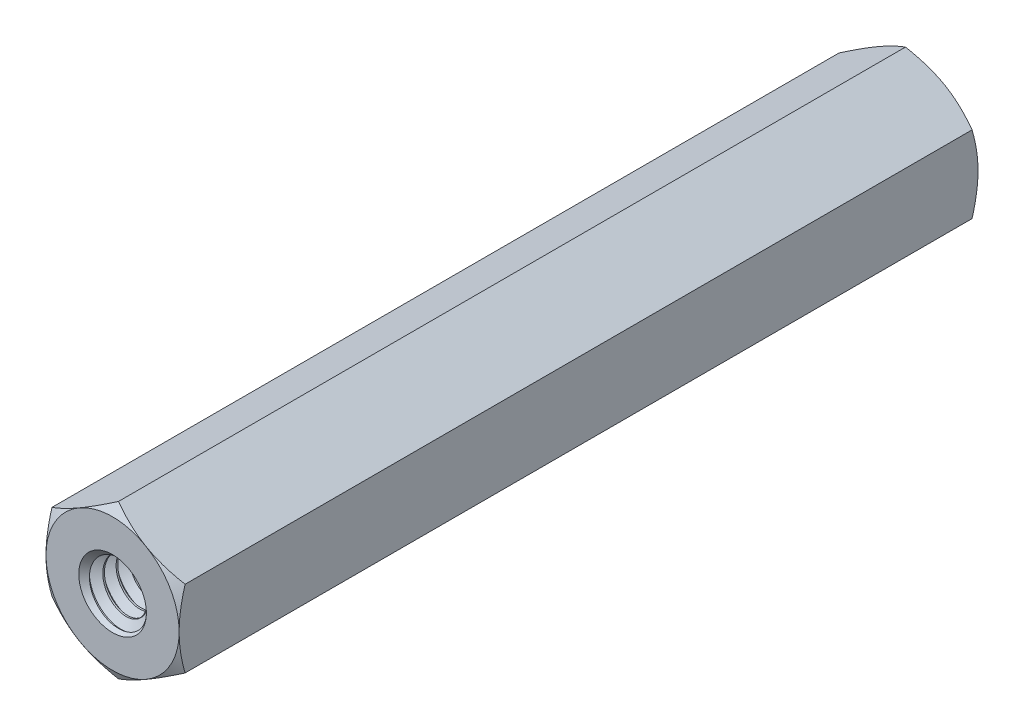
from build123d import *

# Parameters (mm, degrees)
EXTRUDE1_DEPTH          = 38.1
EXTRUDE1_DEPTH_BACK     = 38.1
SKETCH1_R               = 3.175
SWEEP1_PITCH            = 1.27
EXTRUDE2_DEPTH          = 79.075050996
SKETCH8_OUTSIDE_W       = 304.596
SKETCH8_OUTSIDE_H       = 306.56
SKETCH8_OUTSIDE_R       = 6.35
EXTRUDE4_DEPTH          = 79.075050996
EXTRUDE4_DRAFT          = -60
MIRROR1_COPY_1_SKETCH_W = 304.596
MIRROR1_COPY_1_SKETCH_H = 306.56
MIRROR1_COPY_1_SKETCH_R = 6.35
MIRROR1_COPY_1_DEPTH    = 79.075050996
MIRROR1_COPY_1_DRAFT    = -60
SKETCH9_W               = 44.45
SKETCH9_H               = 3.2258


with BuildPart() as part:
    # Sketch1 → Extrude1 (new, two sides: drawn at the far end of the back side and taken through both)
    with BuildSketch(Plane.XY.offset(-EXTRUDE1_DEPTH_BACK)):
        Polygon((0, 7.332348419), (-6.35, 3.666174209), (-6.35, -3.666174209), (0, -7.332348419), (6.35, -3.666174209), (6.35, 3.666174209), align=None)
        with Locations(Location((0, 0, 0), (0, 0, 180))):
            Circle(SKETCH1_R, mode=Mode.SUBTRACT)
    extrude(amount=EXTRUDE1_DEPTH + EXTRUDE1_DEPTH_BACK)

    # Sweep1: the profile of Sketch12 profile screwed along a right-hand helix of 61 turns, 6 arcs to a turn; built about Z, then put on its axis
    sweep1_z = Axis((0, 0, 0), (0, 0, 1))
    sweep1_corners = [(3.1753, 0, -1.111423205), (3.1753, 0, 0.000173205), (2.350110803, 0, -0.47625), (2.350110803, 0, -0.635)]
    with BuildLine(mode=Mode.PRIVATE) as sweep1_profile:
        Line(sweep1_corners[0], sweep1_corners[1])
        Line(sweep1_corners[1], sweep1_corners[2])
        Line(sweep1_corners[2], sweep1_corners[3])
        Line(sweep1_corners[3], sweep1_corners[0])
    sweep1_cap = Face(sweep1_profile.wire())
    sweep1_turn_angles = [0, 30, 60, 90, 120, 150, 180, 210, 240, 270, 300, 330, 360, 390, 420, 450, 480, 510, 540, 570, 600, 630, 660, 690, 720]
    sweep1_turn_weights = [1, 0.8660254037844387, 1, 0.8660254037844387, 1, 0.8660254037844387, 1, 0.8660254037844387, 1, 0.8660254037844387, 1, 0.8660254037844387, 1, 0.8660254037844387, 1, 0.8660254037844387, 1, 0.8660254037844387, 1, 0.8660254037844387, 1, 0.8660254037844387, 1, 0.8660254037844387, 1]
    sweep1_turn_rails = [Edge.make_bspline([Vector(p[0], p[1], 0).rotate(sweep1_z, sweep1_turn_angles[k]) / sweep1_turn_weights[k] + Vector(0, 0, p[2] + SWEEP1_PITCH * sweep1_turn_angles[k] / 360) for k in range(25)], [0, 0, 0, 1, 1, 2, 2, 3, 3, 4, 4, 5, 5, 6, 6, 7, 7, 8, 8, 9, 9, 10, 10, 11, 11, 12, 12, 12], 2, sweep1_turn_weights) for p in sweep1_corners]
    sweep1_turn_sides = [Face.make_surface_from_curves(sweep1_turn_rails[p[0]], sweep1_turn_rails[p[1]]) for p in [(0, 1), (1, 2), (2, 3), (3, 0)]]
    sweep1_last_angles = [21600, 21630, 21660, 21690, 21720, 21750, 21780, 21810, 21840, 21870, 21900, 21930, 21960]
    sweep1_last_weights = [1, 0.8660254037844387, 1, 0.8660254037844387, 1, 0.8660254037844387, 1, 0.8660254037844387, 1, 0.8660254037844387, 1, 0.8660254037842006, 1]
    sweep1_last_rails = [Edge.make_bspline([Vector(p[0], p[1], 0).rotate(sweep1_z, sweep1_last_angles[k]) / sweep1_last_weights[k] + Vector(0, 0, p[2] + SWEEP1_PITCH * sweep1_last_angles[k] / 360) for k in range(13)], [0, 0, 0, 1, 1, 2, 2, 3, 3, 4, 4, 5, 5, 6, 6, 6], 2, sweep1_last_weights) for p in sweep1_corners]
    sweep1_last_sides = [Face.make_surface_from_curves(sweep1_last_rails[p[0]], sweep1_last_rails[p[1]]) for p in [(0, 1), (1, 2), (2, 3), (3, 0)]]
    sweep1 = Plane(origin=(0, 0, -38.1), x_dir=(0, 1, 0), z_dir=(0, 0, 1)) * Solid(Shell([*[p.moved(Location((0, 0, 2 * SWEEP1_PITCH * i))) for i in range(30) for p in sweep1_turn_sides], *sweep1_last_sides, sweep1_cap, sweep1_cap.rotate(sweep1_z, 21960).moved(Location((0, 0, SWEEP1_PITCH * 21960 / 360)))]))
    add(sweep1)

    # Sketch6 → Extrude2 (cut, through all)
    with BuildSketch(Plane(origin=(0, 0, -38.1), x_dir=(-1, 0, 0), z_dir=(0, 0, -1))):
        Polygon((0, 7.332348419), (-6.35, 3.666174209), (-6.35, -3.666174209), (0, -7.332348419), (6.35, -3.666174209), (6.35, 3.666174209), align=None)
    extrude2 = extrude(amount=EXTRUDE2_DEPTH, mode=Mode.SUBTRACT)

    # Extrude3 cone 1 section (through the dimple's axis) → Extrude3 (revolve, cut)
    with BuildSketch(Plane(origin=(0, 0, -38.1), x_dir=(0, 1, 0), z_dir=(1, 0, 0))):
        Polygon((0, 0), (3.2258, 0), (0, 3.459246985), align=None)
    extrude3 = revolve(axis=Axis((0, 0, -38.1), (0, 0, 1)), mode=Mode.SUBTRACT)


with BuildPart() as extrude4_tool:
    # Sketch8 outside → Extrude4 (with draft: the straight prism first)
    with BuildSketch(Plane(origin=(0, 0, -38.1), x_dir=(-1, 0, 0), z_dir=(0, 0, -1))):
        Rectangle(SKETCH8_OUTSIDE_W, SKETCH8_OUTSIDE_H)
        Circle(SKETCH8_OUTSIDE_R, mode=Mode.SUBTRACT)
    extrude(amount=-EXTRUDE4_DEPTH)
    # Extrude4: the draft: its side faces are tilted about the plane it starts from
    extrude4_sides = [extrude4_tool.faces().sort_by_distance(p)[0] for p in [
        (0, -153.28, 1.437525498),
        (-152.298, 0, 1.437525498),
        (0, 153.28, 1.437525498),
        (152.298, 0, 1.437525498),
        (6.35, 0, 1.437525498),
    ]]
    draft(extrude4_sides, Plane(origin=(0, 0, -38.1), x_dir=(-1, 0, 0), z_dir=(0, 0, -1)), EXTRUDE4_DRAFT)


with BuildPart() as part_1:
    add(part.part)

    # Extrude4: cut by extrude4_tool
    add(extrude4_tool.part, mode=Mode.SUBTRACT)

    # Mirror1: Extrude2, Extrude3 across plane
    add(extrude2.mirror(Plane.XY), mode=Mode.SUBTRACT)
    add(extrude3.mirror(Plane.XY), mode=Mode.SUBTRACT)


with BuildPart() as mirror1_copy_1_tool:
    # Mirror1 copy 1 sketch → Mirror1 copy 1 (with draft: the straight prism first)
    with BuildSketch(Plane(origin=(0, 0, 38.1), x_dir=(-1, 0, 0), z_dir=(0, 0, 1))):
        Rectangle(MIRROR1_COPY_1_SKETCH_W, MIRROR1_COPY_1_SKETCH_H)
        Circle(MIRROR1_COPY_1_SKETCH_R, mode=Mode.SUBTRACT)
    extrude(amount=-MIRROR1_COPY_1_DEPTH)
    # Mirror1 copy 1: the draft: its side faces are tilted about the plane it starts from
    mirror1_copy_1_sides = [mirror1_copy_1_tool.faces().sort_by_distance(p)[0] for p in [
        (0, -153.28, -1.437525498),
        (-152.298, 0, -1.437525498),
        (0, 153.28, -1.437525498),
        (152.298, 0, -1.437525498),
        (6.35, 0, -1.437525498),
    ]]
    draft(mirror1_copy_1_sides, Plane(origin=(0, 0, 38.1), x_dir=(-1, 0, 0), z_dir=(0, 0, 1)), MIRROR1_COPY_1_DRAFT)


with BuildPart() as part_2:
    add(part_1.part)

    # Mirror1 copy 1: cut by mirror1_copy_1_tool
    add(mirror1_copy_1_tool.part, mode=Mode.SUBTRACT)

    # Sketch9 → Revolve 2 (revolve)
    with BuildSketch(Plane(origin=(0, 0, 0), x_dir=(0, 0, -1), z_dir=(1, 0, 0)), mode=Mode.PRIVATE) as revolve_2_sk:
        with Locations((0, 1.6129)):
            Rectangle(SKETCH9_W, SKETCH9_H)
    revolve(revolve_2_sk.sketch.rotate(Axis((0, 0, 38.1), (0, 0, -1)), 270), axis=Axis((0, 0, 38.1), (0, 0, -1)))


solid = part_2.part
